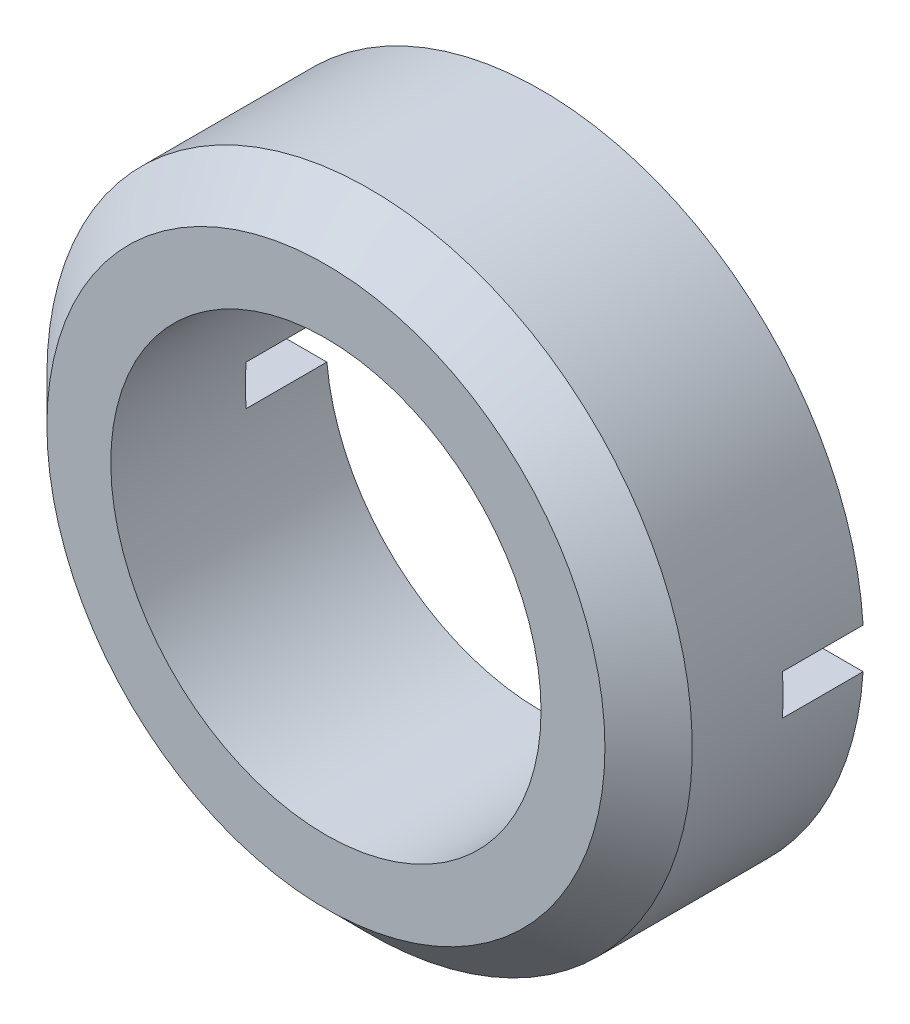
from build123d import *

# Parameters (mm, degrees)
SKETCH_1_R               = 12
SKETCH_1_R_2             = 8
EXTRUDE_1_DEPTH          = 4
CUT_EXTRUDE_1_DEPTH      = 19.761663039
CUT_EXTRUDE_1_DEPTH_BACK = 3
SKETCH_3_W               = 39.283858622
SKETCH_3_H               = 1.5


# Read off the part's stored shape, not the designer's step: M24 机械螺纹 螺柱1
with BuildPart() as part:
    # 草图1 → 凸台-拉伸1 (new, symmetric)
    with BuildSketch(Plane.XY):
        Circle(SKETCH_1_R)
        Circle(SKETCH_1_R_2, mode=Mode.SUBTRACT)
    extrude(amount=EXTRUDE_1_DEPTH, both=True)

    # M24 机械螺纹 螺柱1 outline → M24 机械螺纹 螺柱1 (revolve, cut)
    with BuildSketch(Plane.XZ):
        Polygon((12, 4), (10.376, 4), (12, 2.376), align=None)
    revolve(axis=Axis((0, 0, 0), (0, 0, 1)), mode=Mode.SUBTRACT)

    # 草图3 → 切除-拉伸-薄壁1 (cut, two sides: drawn at the far end of the back side and taken through both)
    with BuildSketch(Plane(origin=(0, 0, -4), x_dir=(-1, 0, 0), z_dir=(0, 0, -1)).offset(-CUT_EXTRUDE_1_DEPTH_BACK)):
        Rectangle(SKETCH_3_W, SKETCH_3_H)
    extrude(amount=CUT_EXTRUDE_1_DEPTH + CUT_EXTRUDE_1_DEPTH_BACK, mode=Mode.SUBTRACT)


solid = part.part
